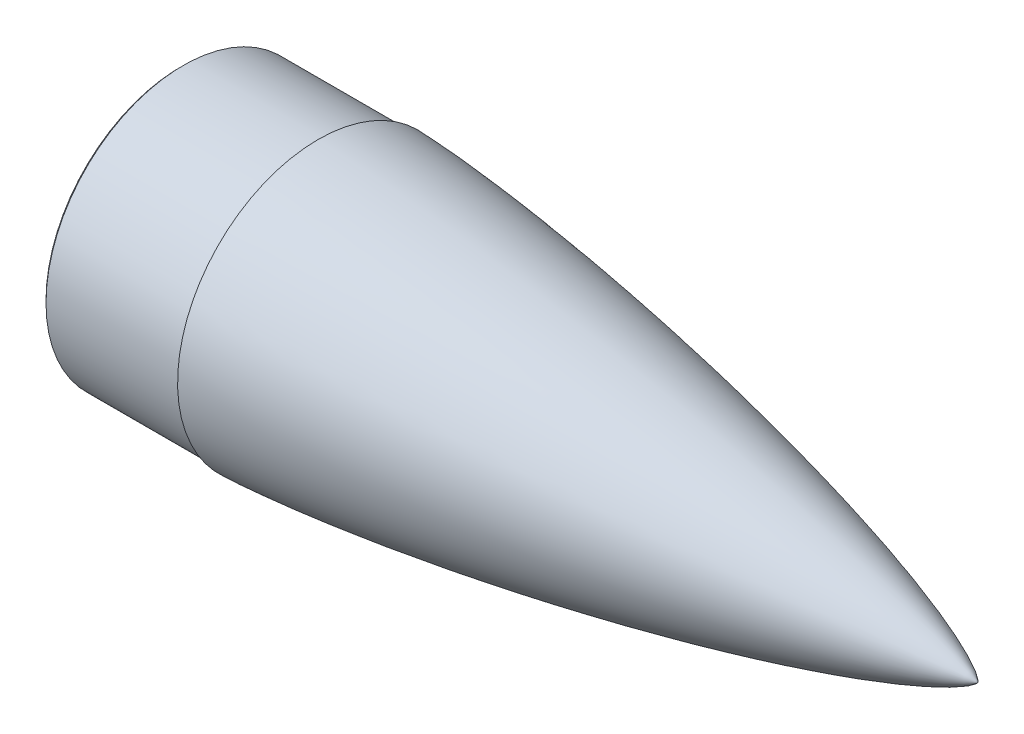
from build123d import *

# Parameters (mm, degrees)
CHAMFER1_SIZE = 1.5


with BuildPart() as part:
    # Sketch10 → Revolve1 (revolve)
    with BuildSketch(Plane.XY):
        with BuildLine():
            Line((11.112493743, 81.99983), (-84.604517473, 81.99983))
            Line((-84.604517473, 81.99983), (-84.604517473, 84.99983))
            Line((-84.604517473, 84.99983), (0.395312527, 84.99983))
            Line((0.395312527, 84.99983), (0.395312527, 86.99983))
            add(Edge.make_bspline(
                [(408.967251823, 0), (408.964913524, 0.013501739), (408.958040758, 0.039916077), (408.936520441, 0.090485698), (408.892222076, 0.174057132), (408.826281575, 0.275556803), (408.721696416, 0.415833756), (408.561101809, 0.605075245), (408.30561918, 0.87242415), (407.86966713, 1.275299562), (407.120955138, 1.885142115), (405.803773451, 2.82590185), (403.46240692, 4.287152794), (399.325294488, 6.531818454), (392.481146888, 9.758904649), (380.662076725, 14.628008466), (363.637187185, 20.711720382), (342.215241093, 27.476512989), (317.428462321, 34.49762647), (291.879335737, 41.10482439), (266.21046092, 47.228993169), (240.44548836, 52.933436777), (214.598861982, 58.255439009), (188.68089566, 63.217582693), (165.946174917, 67.253280679), (146.421982586, 70.493799722), (130.127893898, 73.044947468), (117.078590637, 74.994157933), (104.015464216, 76.84854079), (92.573263959, 78.384492045), (82.757139441, 79.635603973), (74.571340184, 80.632219902), (68.019260454, 81.400804211), (61.463723364, 82.139375899), (54.90469802, 82.84637726), (48.342159918, 83.519940506), (41.776057559, 84.15778717), (36.02754108, 84.682157239), (31.097921259, 85.105234912), (26.988317923, 85.438669825), (23.699666618, 85.693218594), (20.085807822, 85.958448038), (16.719873821, 86.189018485), (13.602098287, 86.386966779), (10.732704013, 86.554575744), (8.436635008, 86.678703291), (6.139997341, 86.792157585), (4.129892063, 86.879313264), (2.40653858, 86.944618982), (1.257348635, 86.979022496), (0.68269791, 86.99491462), (0.395312527, 86.99983)],
                knots=[0, 0, 0, 0, 0, 0.000130123, 0.000260245, 0.000520491, 0.000900391, 0.00128029, 0.001925099, 0.002881508, 0.004418208, 0.006927086, 0.011110697, 0.018279138, 0.03067276, 0.051704469, 0.08310228, 0.139908797, 0.202702513, 0.265496165, 0.328289682, 0.391083359, 0.453876973, 0.516670577, 0.579464197, 0.642257765, 0.673654596, 0.705051427, 0.736448267, 0.767845106, 0.799241874, 0.814940257, 0.830638641, 0.846337073, 0.862035505, 0.877733936, 0.893432368, 0.90913072, 0.924829072, 0.932678248, 0.940527424, 0.9483766, 0.956225776, 0.967169332, 0.97264111, 0.978112888, 0.983584666, 0.989056444, 0.994528222, 0.997264111, 1, 1, 1, 1, 1], degree=4))
            Line((408.967251823, 0), (368.967251823, 0))
            add(Edge.make_bspline(
                [(368.967251823, 0), (368.965299543, 0.012338489), (368.959416882, 0.036518378), (368.940636147, 0.082964007), (368.902304552, 0.158736421), (368.845538097, 0.250270687), (368.755690124, 0.376555746), (368.616653262, 0.54835284), (368.392888737, 0.793577299), (368.008659121, 1.164904965), (367.344738263, 1.729853685), (366.176060796, 2.601559154), (364.09282389, 3.960032328), (360.425978756, 6.040734396), (354.402196649, 9.01831007), (344.042994901, 13.507695011), (329.152005398, 19.128483965), (310.425167902, 25.398569259), (288.741266406, 31.933693508), (266.378532845, 38.106125474), (243.901379123, 43.846895186), (221.331994001, 49.212017941), (198.683967629, 54.234500927), (175.966897581, 58.934255644), (156.034567874, 62.771715365), (138.913309407, 65.864527435), (124.622146642, 68.307661522), (113.175433683, 70.17967865), (101.715073011, 71.96636138), (91.675400162, 73.451702031), (83.061477555, 74.665911128), (75.877508043, 75.636304155), (70.126883477, 76.386726745), (64.372781617, 77.110069349), (58.61515849, 77.804909351), (52.853975896, 78.469544472), (47.089163585, 79.101886687), (42.041698521, 79.62465649), (37.712905728, 80.048834251), (34.103930019, 80.384978489), (31.21573691, 80.642790078), (28.064782604, 80.911008917), (24.650683878, 81.18433613), (21.465442499, 81.419549228), (18.509298065, 81.617697726), (16.044835899, 81.767029289), (14.319122179, 81.861163774), (12.839491242, 81.933559207), (11.852734629, 81.973930117), (11.359294454, 81.99295272), (11.112493743, 81.99983)],
                knots=[0, 0, 0, 0, 0, 0.000134949, 0.000269899, 0.000539798, 0.000919537, 0.001299277, 0.001947431, 0.00293136, 0.004511869, 0.007081312, 0.011380263, 0.018707867, 0.031423867, 0.052705479, 0.084103008, 0.140910136, 0.203703492, 0.266497064, 0.329290816, 0.392084375, 0.454877964, 0.517671564, 0.580465191, 0.643258828, 0.674655593, 0.706052358, 0.737449114, 0.768845869, 0.800242661, 0.815941057, 0.831639453, 0.847337924, 0.863036395, 0.878734865, 0.894433336, 0.910131716, 0.925830096, 0.933679285, 0.941528475, 0.949377665, 0.957226855, 0.967920141, 0.978613427, 0.983960071, 0.989306714, 0.994653357, 0.997326678, 1, 1, 1, 1, 1], degree=4))
        make_face()
    revolve(axis=Axis((46.917858469, 0, 0), (-1, 0, 0)))

    # Chamfer1
    chamfer1_edges = [part.edges().sort_by_distance(p)[0] for p in [
        (-84.604517473, -84.99983, 0),
    ]]
    chamfer(chamfer1_edges, length=CHAMFER1_SIZE)


solid = part.part
